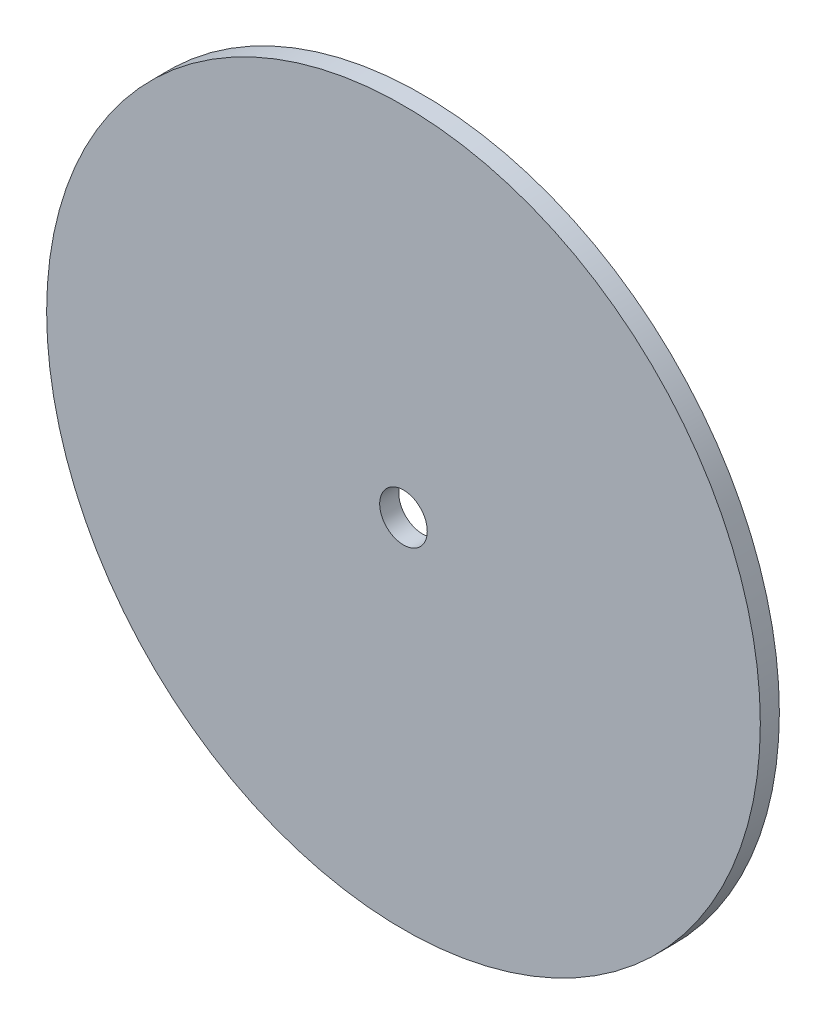
from build123d import *

# Parameters (mm, degrees)
SKETCH1_R          = 37.5
BASE_FLANGE1_DEPTH = 2
SKETCH6_R          = 2.5
CUT_EXTRUDE1_DEPTH = 10


# Sheet-metal steps are written as plain solids
with BuildPart() as part:
    # Sketch1 → Base-Flange1 (new body)
    with BuildSketch(Plane.XY):
        Circle(SKETCH1_R)
    extrude(amount=-BASE_FLANGE1_DEPTH)

    # Sketch6 → Cut-Extrude1 (cut)
    with BuildSketch(Plane.XY):
        Circle(SKETCH6_R)
    extrude(amount=-CUT_EXTRUDE1_DEPTH, mode=Mode.SUBTRACT)


solid = part.part
